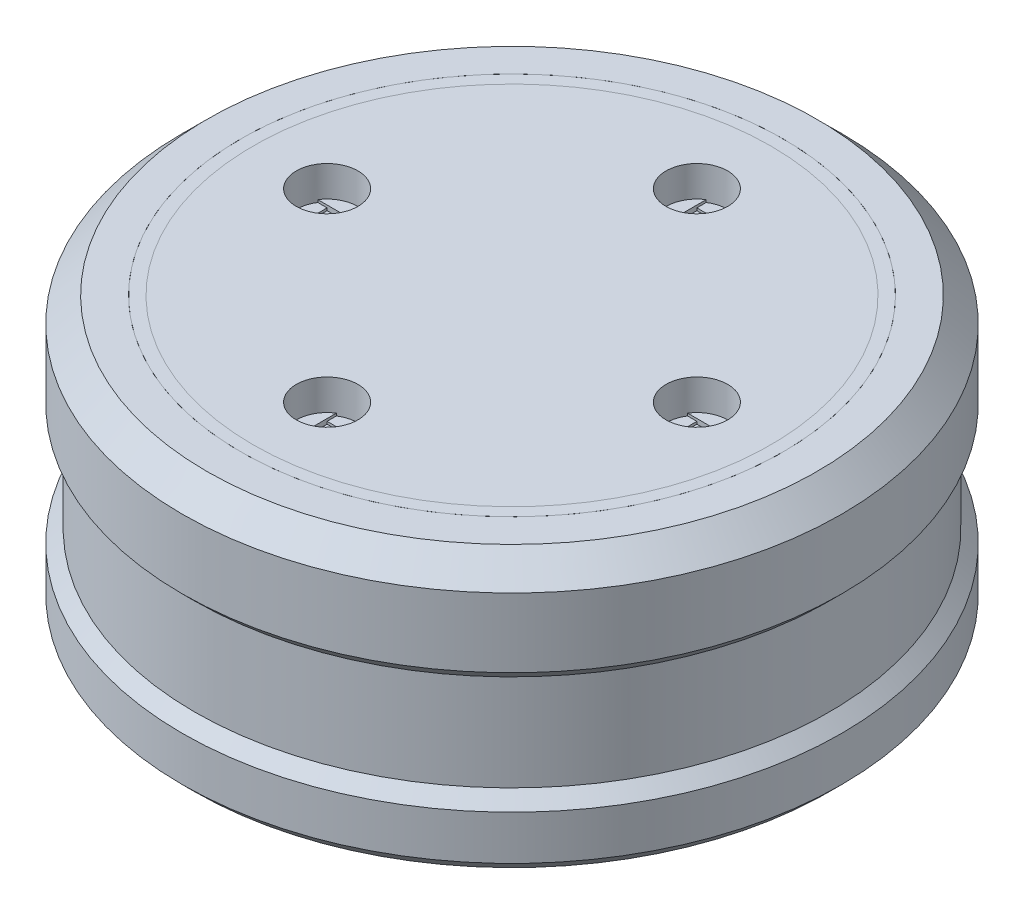
from build123d import *
from build123d.topology import SkipClean

# Parameters (mm, degrees)
SKETCH1_R               = 26.75
SKETCH1_R_2             = 1.35
BOSS_EXTRUDE1_DEPTH     = 25
SKETCH2_R               = 25
CUT_EXTRUDE1_DEPTH      = 20
SKETCH3_W               = 1
SKETCH3_H               = 9.8
CHAMFER1_SIZE           = 2
CHAMFER2_SIZE           = 1
CHAMFER3_SIZE           = 1
SKETCH4_R               = 2.5
CUT_EXTRUDE2_DEPTH      = 2.5
CUT_EXTRUDE3_DEPTH      = 0.2
SKETCH6_W               = 2.7
SKETCH6_H               = 2.7
CUT_EXTRUDE4_DEPTH      = 0.2
CIRPATTERN1_COUNT       = 4
CUT_EXTRUDE5_DEPTH      = 46.344514552
CUT_EXTRUDE5_DEPTH_BACK = 46.344514552
SKETCH7_W               = 53.5
SKETCH7_H               = 3
CHAMFER4_SIZE           = 1
CUT_EXTRUDE6_DEPTH      = 44.762141172
CUT_EXTRUDE6_DEPTH_BACK = 0.6
SKETCH8_R               = 22
SKETCH8_R_2             = 21
SKETCH8_2_R             = 22
SKETCH8_2_R_2           = 21
BOSS_EXTRUDE2_DEPTH     = 0.6


with BuildPart() as part:
    # Sketch1 → Boss-Extrude1 (new body)
    with BuildSketch(Plane(origin=(0, 0, 0), x_dir=(1, 0, 0), z_dir=(0, 1, 0))):
        with Locations(Location((0, 0, 0), (0, 0, 270))):
            Circle(SKETCH1_R)
        with Locations(Location((0, 15, 0), (0, 0, 270))):
            Circle(SKETCH1_R_2, mode=Mode.SUBTRACT)
        with Locations(Location((15, 0, 0), (0, 0, 270))):
            Circle(SKETCH1_R_2, mode=Mode.SUBTRACT)
        with Locations(Location((0, -15, 0), (0, 0, 270))):
            Circle(SKETCH1_R_2, mode=Mode.SUBTRACT)
        with Locations(Location((-15, 0, 0), (0, 0, 270))):
            Circle(SKETCH1_R_2, mode=Mode.SUBTRACT)
    extrude(amount=BOSS_EXTRUDE1_DEPTH)

    # Sketch2 → Cut-Extrude1 (cut)
    with BuildSketch(Plane.XZ):
        with Locations(Location((0, 0, 0), (0, 0, 270))):
            Circle(SKETCH2_R)
    extrude(amount=-CUT_EXTRUDE1_DEPTH, mode=Mode.SUBTRACT)

    # Sketch3 → Cut-Revolve1 (revolve, cut)
    with BuildSketch(Plane(origin=(0, 0, 0), x_dir=(0, 0, -1), z_dir=(1, 0, 0)), mode=Mode.PRIVATE) as cut_revolve1_sk:
        with Locations((-26.25, 12.5)):
            Rectangle(SKETCH3_W, SKETCH3_H)
    revolve(cut_revolve1_sk.sketch.rotate(Axis((0, 0, 0), (0, 1, 0)), 180), axis=Axis((0, 0, 0), (0, 1, 0)), mode=Mode.SUBTRACT)

    # Chamfer1
    chamfer1_edges = [part.edges().sort_by_distance(p)[0] for p in [
        (0, 25, -26.75),
    ]]
    chamfer(chamfer1_edges, length=CHAMFER1_SIZE)

    # Chamfer2
    chamfer2_edges = [part.edges().sort_by_distance(p)[0] for p in [
        (0, 7.6, 25.75),
        (0, 17.4, 25.75),
    ]]
    chamfer(chamfer2_edges, length=CHAMFER2_SIZE - 0.0001)  # a hair under: the kernel refuses the full size

    # Chamfer3
    chamfer3_edges = [part.edges().sort_by_distance(p)[0] for p in [
        (0, 0, -26.75),
    ]]
    chamfer(chamfer3_edges, length=CHAMFER3_SIZE)

    # Sketch4 → Cut-Extrude2 (cut)
    with BuildSketch(Plane(origin=(0, 25, 0), x_dir=(1, 0, 0), z_dir=(0, 1, 0))):
        with Locations(Location((0, 15, 0), (0, 0, 270))):
            Circle(SKETCH4_R)
        with Locations(Location((15, 0, 0), (0, 0, 270))):
            Circle(SKETCH4_R)
        with Locations(Location((0, -15, 0), (0, 0, 270))):
            Circle(SKETCH4_R)
        with Locations(Location((-15, 0, 0), (0, 0, 270))):
            Circle(SKETCH4_R)
    extrude(amount=-CUT_EXTRUDE2_DEPTH, mode=Mode.SUBTRACT)

    # Sketch5 → Cut-Extrude3 (cut)
    with SkipClean():  # the faces are left unmerged after this step: merging them gives an invalid solid
        with BuildSketch(Plane(origin=(0, 22.5, 0), x_dir=(1, 0, 0), z_dir=(0, 1, 0))):
            with BuildLine():
                Line((-1.35, 12.895837459), (-1.35, 17.104162541))
                ThreePointArc((-1.35, 17.104162541), (0, 17.5), (1.35, 17.104162541))
                Line((1.35, 17.104162541), (1.35, 12.895837459))
                ThreePointArc((1.35, 12.895837459), (0, 12.5), (-1.35, 12.895837459))
            make_face()
        cut_extrude3 = extrude(amount=-CUT_EXTRUDE3_DEPTH, mode=Mode.SUBTRACT)

    # Sketch6 → Cut-Extrude4 (cut)
    with SkipClean():  # the faces are left unmerged after this step: merging them gives an invalid solid
        with BuildSketch(Plane(origin=(0, 22.3, 0), x_dir=(1, 0, 0), z_dir=(0, 1, 0))):
            with Locations((0, 15)):
                Rectangle(SKETCH6_W, SKETCH6_H)
        cut_extrude4 = extrude(amount=-CUT_EXTRUDE4_DEPTH, mode=Mode.SUBTRACT)

    # CirPattern1: Cut-Extrude3, Cut-Extrude4 ×4 about axis
    with SkipClean():  # the faces are left unmerged after this step: merging them gives an invalid solid
        cirpattern1_axis = Axis((0, 0, 0), (0, 1, 0))
        add([cut_extrude3.rotate(cirpattern1_axis, i * 360 / CIRPATTERN1_COUNT) for i in range(1, CIRPATTERN1_COUNT)], mode=Mode.SUBTRACT)
        add([cut_extrude4.rotate(cirpattern1_axis, i * 360 / CIRPATTERN1_COUNT) for i in range(1, CIRPATTERN1_COUNT)], mode=Mode.SUBTRACT)

    # Sketch7 → Cut-Extrude5 (cut, two sides: drawn at the far end of the back side and taken through both)
    with SkipClean():  # the faces are left unmerged after this step: merging them gives an invalid solid
        with BuildSketch(Plane.XY.offset(-CUT_EXTRUDE5_DEPTH_BACK)):
            with Locations((0, 1.5)):
                Rectangle(SKETCH7_W, SKETCH7_H)
        extrude(amount=CUT_EXTRUDE5_DEPTH + CUT_EXTRUDE5_DEPTH_BACK, mode=Mode.SUBTRACT)

    # Chamfer4
    chamfer4_edges = [part.edges().sort_by_distance(p)[0] for p in [
        (18.915106397, 3, 18.915106397),
    ]]
    chamfer(chamfer4_edges, length=CHAMFER4_SIZE)

    # Sketch8 → Cut-Extrude6 (cut, two sides: drawn at the far end of the back side and taken through both)
    with SkipClean():  # the faces are left unmerged after this step: merging them gives an invalid solid
        with BuildSketch(Plane(origin=(0, 25, 0), x_dir=(1, 0, 0), z_dir=(0, 1, 0)).offset(-CUT_EXTRUDE6_DEPTH_BACK)):
            with Locations(Location((0, 0, 0), (0, 0, 90))):
                Circle(SKETCH8_R)
            with Locations(Location((0, 0, 0), (0, 0, 90))):
                Circle(SKETCH8_R_2, mode=Mode.SUBTRACT)
        extrude(amount=CUT_EXTRUDE6_DEPTH + CUT_EXTRUDE6_DEPTH_BACK, mode=Mode.SUBTRACT)


with BuildPart() as body_2:
    # Sketch8<2> → Boss-Extrude2 (new body)
    with BuildSketch(Plane(origin=(0, 25, 0), x_dir=(1, 0, 0), z_dir=(0, 1, 0))):
        with Locations(Location((0, 0, 0), (0, 0, 270))):
            Circle(SKETCH8_2_R)
        with Locations(Location((0, 0, 0), (0, 0, 270))):
            Circle(SKETCH8_2_R_2, mode=Mode.SUBTRACT)
    extrude(amount=-BOSS_EXTRUDE2_DEPTH)


solid = Compound([part.part, body_2.part])
